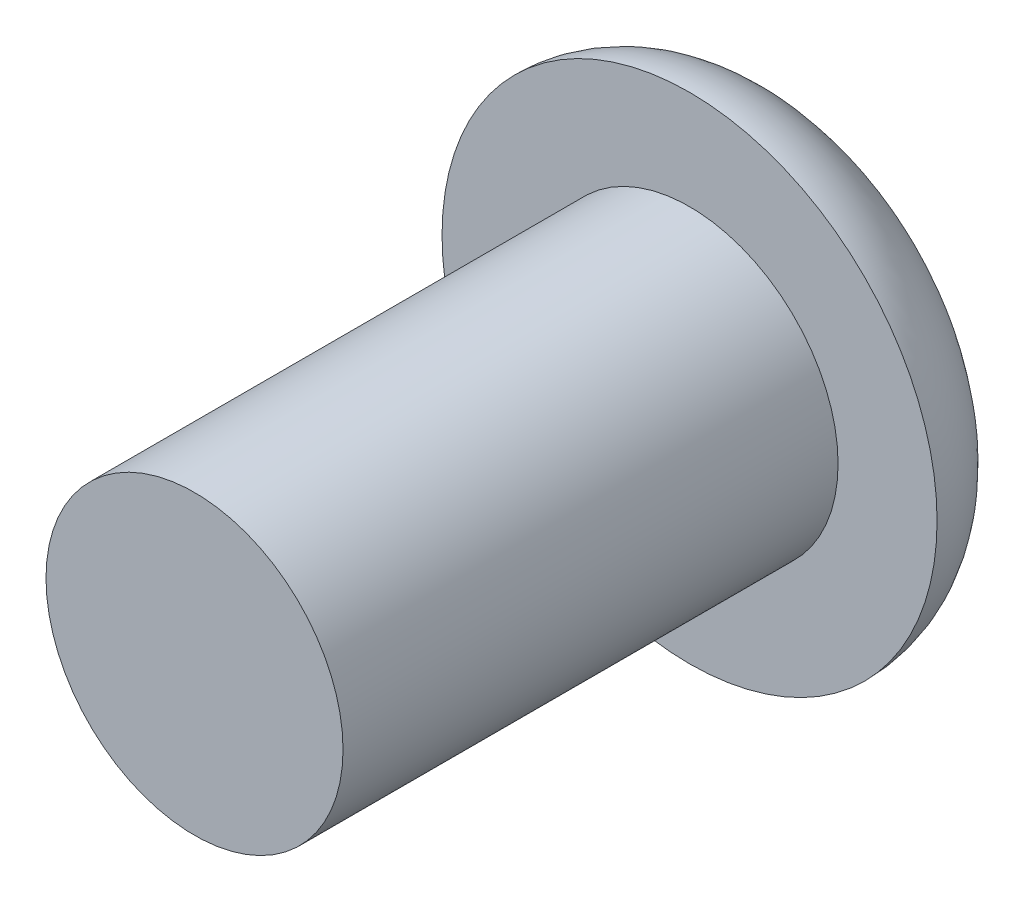
from build123d import *

# Parameters (mm, degrees)
ESQUISSE1_R          = 5
BASE_EXTRUSION_DEPTH = 2
ESQUISSE2_R          = 3
BOSS_EXTRU_1_DEPTH   = 10
CONG_1_R             = 2


with BuildPart() as part:
    # Esquisse1 → Base-Extrusion (new body)
    with BuildSketch(Plane.XY):
        Circle(ESQUISSE1_R)
    extrude(amount=BASE_EXTRUSION_DEPTH)

    # Esquisse2 → Boss.-Extru.1 (add)
    with BuildSketch(Plane.XY.offset(2)):
        Circle(ESQUISSE2_R)
    extrude(amount=BOSS_EXTRU_1_DEPTH)

    # Congé1
    cong_1_edges = [part.edges().sort_by_distance(p)[0] for p in [
        (-5, 0, 0),
    ]]
    fillet(cong_1_edges, radius=CONG_1_R - 0.0001)  # a hair under: the kernel refuses the full size


solid = part.part
